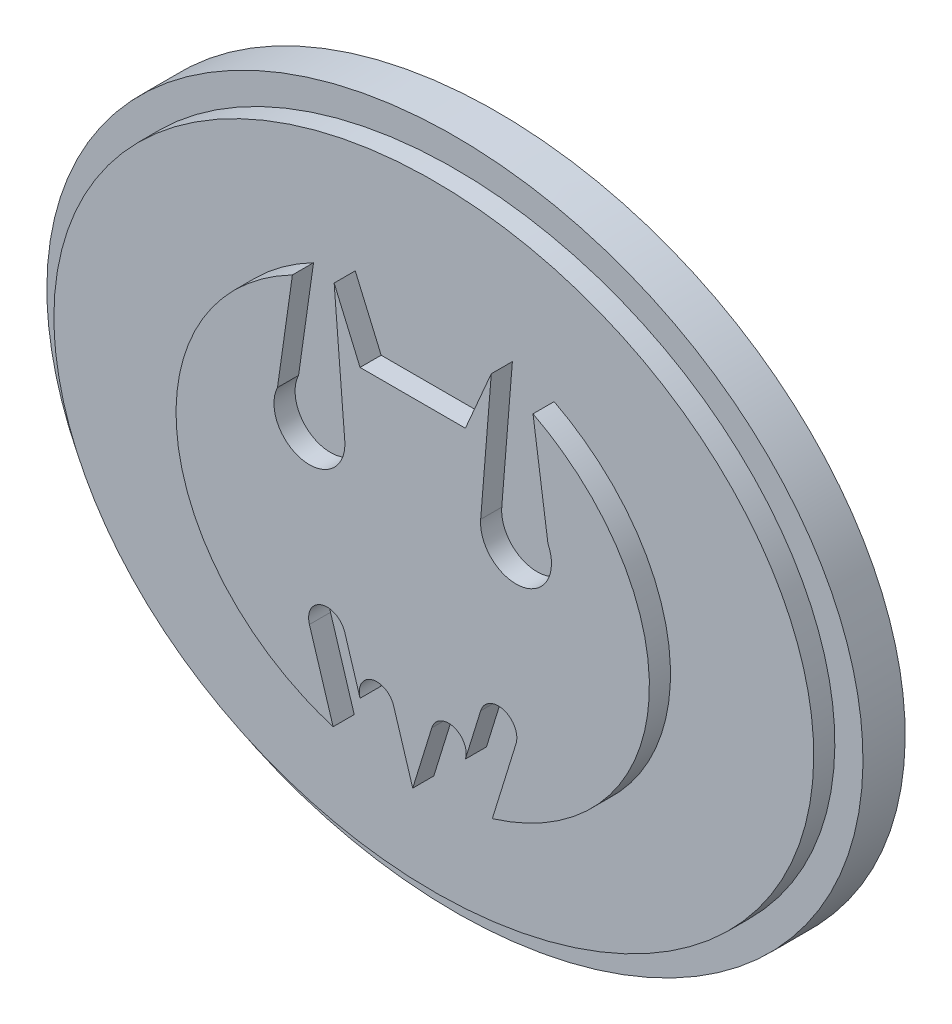
from build123d import *

# Parameters (mm, degrees)
BOSS_EXTRUDE2_DEPTH = 6
SKETCH2_RX          = 108.02935923
SKETCH2_RY          = 87.522725338
BOSS_EXTRUDE3_DEPTH = 6
BOSS_EXTRUDE4_DEPTH = 12


# Read off the part's stored shape, not the designer's step: Boss-Extrude4
with BuildPart() as part:
    # Sketch1 → Boss-Extrude2 (new body)
    with BuildSketch(Plane.XY):
        with BuildLine():
            Line((-14.972290532, 37.09711382), (14.972290532, 37.09711382))
            Line((14.972290532, 37.09711382), (22.341616498, 54.194917812))
            Line((22.341616498, 54.194917812), (19.320192745, 16.833628166))
            ThreePointArc((19.320192745, 16.833628166), (31.217015096, 6.107617638), (38.455513392, 20.396978237))
            Line((38.455513392, 20.396978237), (34.205289461, 50.262238212))
            add(Edge.make_bspline(
                [(22.633437569, -55.218186669), (157.942553923, -13.771511035), (34.205289461, 50.262238212)],
                knots=[5.070556846, 5.070556846, 5.070556846, 7.336021132, 7.336021132, 7.336021132], degree=2, weights=[1, 0.424187235, 1]))
            Line((22.633437569, -55.218186669), (29.3709946, -33.406658826))
            ThreePointArc((29.3709946, -33.406658826), (25.897934508, -26.828917063), (19.320192745, -30.301977155))
            Line((19.320192745, -30.301977155), (14.972290532, -44.37746323))
            ThreePointArc((14.972290532, -44.37746323), (11.676547894, -38.135548775), (5.434633438, -41.431291414))
            Line((5.434633438, -41.431291414), (0, -59.024858046))
            Line((0, -59.024858046), (-5.434633438, -41.431291414))
            ThreePointArc((-5.434633438, -41.431291414), (-11.676547894, -38.135548775), (-14.972290532, -44.37746323))
            Line((-14.972290532, -44.37746323), (-19.320192745, -30.301977155))
            ThreePointArc((-19.320192745, -30.301977155), (-25.897934508, -26.828917063), (-29.3709946, -33.406658826))
            Line((-29.3709946, -33.406658826), (-22.633437569, -55.218186669))
            add(Edge.make_bspline(
                [(-34.205289461, 50.262238212), (-157.942553923, -13.771511035), (-22.633437569, -55.218186669)],
                knots=[5.230349482, 5.230349482, 5.230349482, 7.495813768, 7.495813768, 7.495813768], degree=2, weights=[1, 0.424187235, 1]))
            Line((-34.205289461, 50.262238212), (-38.455513392, 20.396978237))
            ThreePointArc((-38.455513392, 20.396978237), (-31.217015096, 6.107617638), (-19.320192745, 16.833628166))
            Line((-19.320192745, 16.833628166), (-22.341616498, 54.194917812))
            Line((-22.341616498, 54.194917812), (-14.972290532, 37.09711382))
        make_face()
    extrude(amount=BOSS_EXTRUDE2_DEPTH)

    # Sketch2 → Boss-Extrude3 (add)
    with BuildSketch(Plane(origin=(0, 0, 0), x_dir=(-1, 0, 0), z_dir=(0, 0, -1))):
        with Locations((0, 0)):
            Ellipse(SKETCH2_RX, SKETCH2_RY)
    extrude(amount=BOSS_EXTRUDE3_DEPTH)


with BuildPart() as body_2:
    # Boss-Extrude4 outline → Boss-Extrude4 (new body)
    with BuildSketch(Plane(origin=(0, 0, -6), x_dir=(-1, 0, 0), z_dir=(0, 0, -1))):
        with BuildLine():
            add(Edge.make_bspline(
                [(116.02935923, 0), (116.02935923, 6.374100521), (114.47617525, 19.122301562), (105.343366539, 43.49891878), (83.466071115, 69.926962918), (44.962837445, 90.702181025), (0, 97.932997495), (-44.962837445, 90.702181025), (-83.466071115, 69.926962918), (-105.343366539, 43.49891878), (-114.47617525, 19.122301562), (-116.80595122, 0), (-114.47617525, -19.122301562), (-105.343366539, -43.49891878), (-83.466071115, -69.926962918), (-44.962837445, -90.702181025), (0, -97.932997495), (44.962837445, -90.702181025), (83.466071115, -69.926962918), (105.343366539, -43.49891878), (114.47617525, -19.122301562), (116.02935923, -6.374100521), (116.02935923, 0)],
                knots=[0, 0, 0, 0, 0.196349541, 0.392699082, 0.785398163, 1.178097245, 1.570796327, 1.963495408, 2.35619449, 2.748893572, 2.945243113, 3.141592654, 3.337942194, 3.534291735, 3.926990817, 4.319689899, 4.71238898, 5.105088062, 5.497787144, 5.890486225, 6.086835766, 6.283185307, 6.283185307, 6.283185307, 6.283185307], degree=3))
        make_face()
        with BuildLine():
            add(Edge.make_bspline(
                [(108.02935923, 0), (108.02935923, 151.593807103), (-54.014679615, 75.796903551), (-216.05871846, 0), (-54.014679615, -75.796903551), (108.02935923, -151.593807103), (108.02935923, 0)],
                knots=[0, 0, 0, 2.094395102, 2.094395102, 4.188790205, 4.188790205, 6.283185307, 6.283185307, 6.283185307], degree=2, weights=[1, 0.5, 1, 0.5, 1, 0.5, 1]))
        make_face(mode=Mode.SUBTRACT)
    extrude(amount=BOSS_EXTRUDE4_DEPTH)


solid = Compound([part.part, body_2.part])
